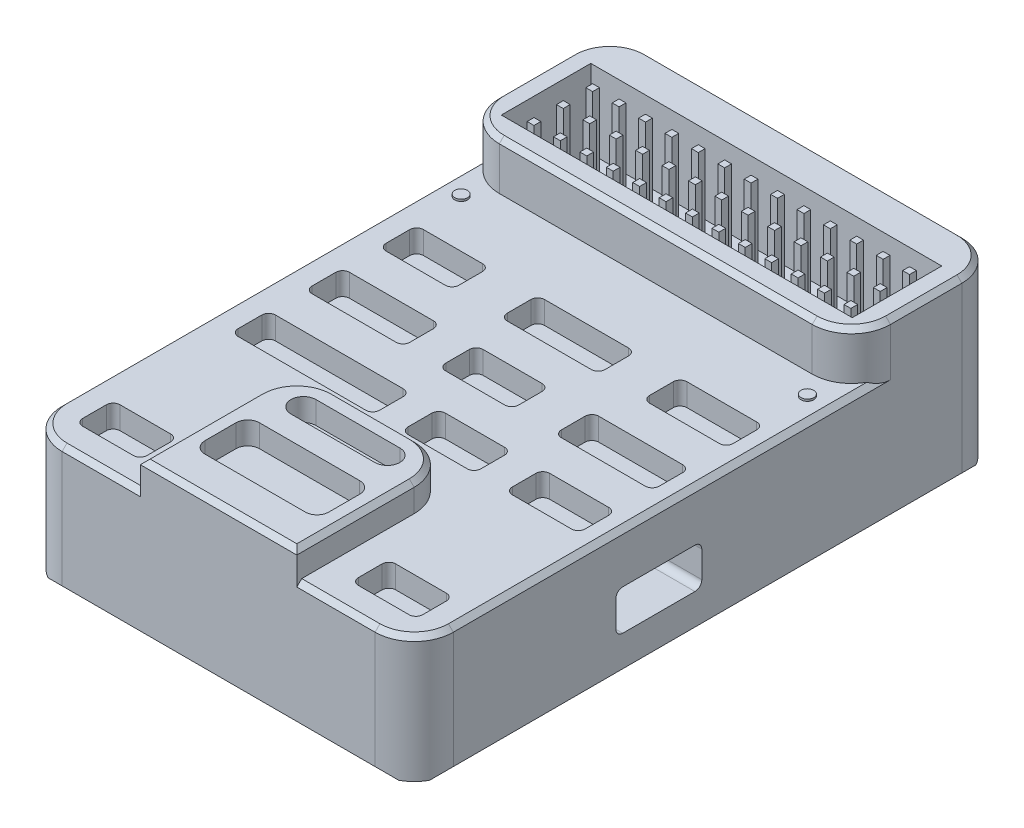
from build123d import *

# Parameters (mm, degrees)
SKETCH_1_W          = 40
SKETCH_1_H          = 60
EXTRUDE_1_DEPTH     = 17.8
SKETCH_2_W          = 44.7
SKETCH_2_H          = 4.9
CUT_EXTRUDE_1_DEPTH = 75.275433355
SKETCH_2_3_W        = 8.783921093
SKETCH_2_3_H        = 4.10647225
CUT_EXTRUDE_2_DEPTH = 5
CUT_EXTRUDE_3_DEPTH = 1.5
CUT_EXTRUDE_4_DEPTH = 4
SKETCH_4_W          = 16
SKETCH_4_H          = 2.833978106
EXTRUDE_2_DEPTH     = 16
SKETCH_5_W          = 7.440863623
SKETCH_5_H          = 3.815065683
SKETCH_5_W_2        = 4.996894502
SKETCH_5_W_3        = 8.530183119
SKETCH_5_W_4        = 3.720431812
SKETCH_5_H_2        = 3.815065684
SKETCH_5_W_5        = 9.986756652
SKETCH_5_W_6        = 14.458699844
SKETCH_5_W_7        = 6.575740644
CUT_EXTRUDE_5_DEPTH = 2.3
SKETCH_6_W          = 12.655666406
SKETCH_6_H          = 5.566059253
CUT_EXTRUDE_6_DEPTH = 2.3
CHAMFER_1_SIZE      = 0.5
FILLET_1_R          = 4
FILLET_2_R          = 4
CHAMFER_10_SIZE     = 0.5
CHAMFER_11_SIZE     = 0.5
FILLET_3_R          = 4
CHAMFER_13_SIZE     = 0.5
SKETCH_9_W          = 17.942606246
SKETCH_9_H          = 9.150280341
CUT_EXTRUDE_7_DEPTH = 8
SKETCH_10_W         = 0.7
SKETCH_10_H         = 0.7
SKETCH_10_W_2       = 0.35
EXTRUDE_5_DEPTH     = 7.5
FILLET_5_R          = 0.7
FILLET_6_R          = 1.2
SKETCH_11_R         = 0.65
EXTRUDE_6_DEPTH     = 0.2


with BuildPart() as part:
    # 草图1 → 凸台-拉伸1 (new body)
    with BuildSketch(Plane(origin=(0, 0, 0), x_dir=(1, 0, 0), z_dir=(0, 1, 0))):
        with Locations((0, 30)):
            Rectangle(SKETCH_1_W, SKETCH_1_H)
    extrude(amount=EXTRUDE_1_DEPTH)

    # 草图2 → 切除-拉伸1 (cut, through all)
    with BuildSketch(Plane.ZY.offset(20)):
        with Locations((-22.35, 15.35)):
            Rectangle(SKETCH_2_W, SKETCH_2_H)
    extrude(amount=-CUT_EXTRUDE_1_DEPTH, mode=Mode.SUBTRACT)

    # 草图2<3> → 切除-拉伸2 (cut)
    with BuildSketch(Plane.ZY.offset(20)):
        with Locations((-25.013417227, 5.703760213)):
            Rectangle(SKETCH_2_3_W, SKETCH_2_3_H)
    cut_extrude_2 = extrude(amount=-CUT_EXTRUDE_2_DEPTH, mode=Mode.SUBTRACT)

    # 草图2<4> → 切除-拉伸3 (cut)
    with BuildSketch(Plane.ZY.offset(20)):
        with BuildLine():
            Line((-40.852927108, 4.403976456), (-34.855352364, 4.403976456))
            ThreePointArc((-34.855352364, 4.403976456), (-33.127203267, 6.132125553), (-34.855352364, 7.86027465))
            Line((-34.855352364, 7.86027465), (-40.852927108, 7.86027465))
            ThreePointArc((-40.852927108, 7.86027465), (-42.581076205, 6.132125553), (-40.852927108, 4.403976456))
        make_face()
        with BuildLine():
            ThreePointArc((-34.855352364, 4.896989878), (-33.620216689, 6.132125553), (-34.855352364, 7.367261227))
            Line((-34.855352364, 7.367261227), (-40.852927108, 7.367261227))
            ThreePointArc((-40.852927108, 7.367261227), (-42.088062782, 6.132125553), (-40.852927108, 4.896989878))
            Line((-40.852927108, 4.896989878), (-34.855352364, 4.896989878))
        make_face(mode=Mode.SUBTRACT)
    extrude(amount=-CUT_EXTRUDE_3_DEPTH, mode=Mode.SUBTRACT)

    # 草图2<5> → 切除-拉伸4 (cut)
    with BuildSketch(Plane.ZY.offset(20)):
        with BuildLine():
            Line((-40.852927108, 4.896989878), (-34.855352364, 4.896989878))
            ThreePointArc((-34.855352364, 4.896989878), (-33.620216689, 6.132125553), (-34.855352364, 7.367261227))
            Line((-34.855352364, 7.367261227), (-40.852927108, 7.367261227))
            ThreePointArc((-40.852927108, 7.367261227), (-42.088062782, 6.132125553), (-40.852927108, 4.896989878))
        make_face()
    extrude(amount=-CUT_EXTRUDE_4_DEPTH, mode=Mode.SUBTRACT)

    # 草图4 → 凸台-拉伸2 (add)
    with BuildSketch(Plane.XY):
        with Locations((0, 14.316989053)):
            Rectangle(SKETCH_4_W, SKETCH_4_H)
    extrude(amount=-EXTRUDE_2_DEPTH)

    # 草图5 → 切除-拉伸5 (cut)
    with BuildSketch(Plane(origin=(0, 12.9, 0), x_dir=(1, 0, 0), z_dir=(0, 1, 0))):
        with Locations((-13.66223089, 35.720151077)):
            Rectangle(SKETCH_5_W, SKETCH_5_H)
        with Locations((-2.498447251, 35.720151077)):
            Rectangle(SKETCH_5_W_2, SKETCH_5_H)
        with Locations((2.498447251, 35.720151077)):
            Rectangle(SKETCH_5_W_2, SKETCH_5_H)
        with Locations((13.828753223, 35.720151077)):
            Rectangle(SKETCH_5_W_3, SKETCH_5_H)
        with Locations((1.860215906, 28.155085393)):
            Rectangle(SKETCH_5_W_4, SKETCH_5_H_2)
        with Locations((-1.860215906, 28.155085393)):
            Rectangle(SKETCH_5_W_4, SKETCH_5_H_2)
        with Locations((13.100466456, 28.155085393)):
            Rectangle(SKETCH_5_W_5, SKETCH_5_H_2)
        with Locations((14.373412971, 20.59001971)):
            Rectangle(SKETCH_5_W, SKETCH_5_H)
        with Locations((3.720431812, 20.59001971)):
            Rectangle(SKETCH_5_W, SKETCH_5_H)
        with Locations((-10.153312779, 20.59001971)):
            Rectangle(SKETCH_5_W_6, SKETCH_5_H)
        with Locations((-14.094792379, 4.696074943)):
            Rectangle(SKETCH_5_W_7, SKETCH_5_H_2)
        with Locations((14.094792379, 4.696074943)):
            Rectangle(SKETCH_5_W_7, SKETCH_5_H_2)
        with Locations((-12.389284375, 28.155085393)):
            Rectangle(SKETCH_5_W_5, SKETCH_5_H_2)
    extrude(amount=-CUT_EXTRUDE_5_DEPTH, mode=Mode.SUBTRACT)

    # 草图6 → 切除-拉伸6 (cut)
    with BuildSketch(Plane(origin=(0, 15.733978106, 0), x_dir=(1, 0, 0), z_dir=(0, 1, 0))):
        with BuildLine():
            Line((-4.290864131, 14.247636384), (4.290864131, 14.247636384))
            ThreePointArc((4.290864131, 14.247636384), (5.571719095, 12.966781419), (4.290864131, 11.685926455))
            Line((4.290864131, 11.685926455), (-4.290864131, 11.685926455))
            ThreePointArc((-4.290864131, 11.685926455), (-5.571719095, 12.966781419), (-4.290864131, 14.247636384))
        make_face()
        with Locations((0, 6.521067289)):
            Rectangle(SKETCH_6_W, SKETCH_6_H)
    extrude(amount=-CUT_EXTRUDE_6_DEPTH, mode=Mode.SUBTRACT)

    # 镜向1: 切除-拉伸2 across plane
    add(cut_extrude_2.mirror(Plane(origin=(0, 0, 0), x_dir=(0, 0, 1), z_dir=(1, 0, 0))), mode=Mode.SUBTRACT)

    # 倒角1
    chamfer_1_edges = [part.edges().sort_by_distance(p)[0] for p in [
        (0, 0, 0),
        (-20, 0, -30),
        (0, 0, -60),
        (20, 0, -30),
    ]]
    chamfer(chamfer_1_edges, length=CHAMFER_1_SIZE)

    # 圆角1
    # the kernel refuses this fillet: 4 mm, written as the material it takes off along each edge
    with BuildSketch(Plane(origin=(-20, -9.5, -60), x_dir=(0, 0, 1), z_dir=(0, 1, 0))) as fillet_1_piece_1:
        with BuildLine():
            CenterArc((FILLET_1_R, FILLET_1_R), FILLET_1_R, 180, 90)
            Line((0, FILLET_1_R), (0, 0))
            Line((0, 0), (FILLET_1_R, 0))
        make_face()
    extrude(amount=37.3, mode=Mode.SUBTRACT)
    with BuildSketch(Plane(origin=(20, -9.5, -60), x_dir=(0, 0, 1), z_dir=(0, 1, 0))) as fillet_1_piece_2:
        with BuildLine():
            CenterArc((FILLET_1_R, -FILLET_1_R), FILLET_1_R, 90, 90)
            Line((0, -FILLET_1_R), (0, 0))
            Line((0, 0), (FILLET_1_R, 0))
        make_face()
    extrude(amount=37.3, mode=Mode.SUBTRACT)
    with BuildSketch(Plane(origin=(20, -9.5, 0), x_dir=(-1, 0, 0), z_dir=(0, 1, 0))) as fillet_1_piece_3:
        with BuildLine():
            CenterArc((FILLET_1_R, -FILLET_1_R), FILLET_1_R, 90, 90)
            Line((0, -FILLET_1_R), (0, 0))
            Line((0, 0), (FILLET_1_R, 0))
        make_face()
    extrude(amount=32.4, mode=Mode.SUBTRACT)
    with BuildSketch(Plane(origin=(-20, -9.5, 0), x_dir=(1, 0, 0), z_dir=(0, 1, 0))) as fillet_1_piece_4:
        with BuildLine():
            CenterArc((FILLET_1_R, FILLET_1_R), FILLET_1_R, 180, 90)
            Line((0, FILLET_1_R), (0, 0))
            Line((0, 0), (FILLET_1_R, 0))
        make_face()
    extrude(amount=32.4, mode=Mode.SUBTRACT)

    # 圆角2
    fillet_2_edges = [part.edges().sort_by_distance(p)[0] for p in [
        (8, 14.316989053, -16),
        (-8, 14.316989053, -16),
    ]]
    fillet(fillet_2_edges, radius=FILLET_2_R)

    # 倒角10
    chamfer_10_edges = [part.edges().sort_by_distance(p)[0] for p in [
        (8, 15.733978106, -6),
        (0, 15.733978106, -16),
        (-8, 15.733978106, -6),
        (-6.828427125, 15.733978106, -14.828427125),
        (6.828427125, 15.733978106, -14.828427125),
        (0, 15.733978106, 0),
    ]]
    chamfer(chamfer_10_edges, length=CHAMFER_10_SIZE)

    # 倒角11
    chamfer_11_edges = [part.edges().sort_by_distance(p)[0] for p in [
        (20, 12.9, -24.35),
        (-20, 12.9, -24.35),
        (12, 12.9, 0),
        (-18.828427125, 12.9, -1.171572875),
        (18.828427125, 12.9, -1.171572875),
        (-12, 12.9, 0),
    ]]
    chamfer(chamfer_11_edges, length=CHAMFER_11_SIZE)

    # 圆角3
    # the kernel refuses this fillet: 4 mm, written as the material it takes off along each edge
    with BuildSketch(Plane(origin=(20, 2.4, -44.7), x_dir=(-1, 0, 0), z_dir=(0, 1, 0))) as fillet_3_piece_1_section:
        with BuildLine():
            CenterArc((FILLET_3_R, -FILLET_3_R), FILLET_3_R, 90, 90)
            Line((0, -FILLET_3_R), (0, 0))
            Line((0, 0), (FILLET_3_R, 0))
        make_face()
    fillet_3_piece_1 = extrude(amount=25.4, mode=Mode.PRIVATE)
    fillet_3_piece_1 = split(fillet_3_piece_1, bisect_by=Plane(origin=(19.807797246, 12.592202754, -46.321821662), z_dir=(0.7071067811865476, 0.7071067811865476, 0)), keep=Keep.TOP, mode=Mode.PRIVATE)
    fillet_3_piece_1 = split(fillet_3_piece_1, bisect_by=Plane(origin=(19.910396328, 12.9, -46.321821662), z_dir=(0, -1, 0)), keep=Keep.TOP, mode=Mode.PRIVATE)
    add(fillet_3_piece_1, mode=Mode.SUBTRACT)
    with BuildSketch(Plane(origin=(20, 2.4, -44.7), x_dir=(-1, 0, 0), z_dir=(0, 1, 0))) as fillet_3_piece_2_section:
        with BuildLine():
            CenterArc((FILLET_3_R, -FILLET_3_R), FILLET_3_R, 90, 90)
            Line((0, -FILLET_3_R), (0, 0))
            Line((0, 0), (FILLET_3_R, 0))
        make_face()
    fillet_3_piece_2 = extrude(amount=25.4, mode=Mode.PRIVATE)
    fillet_3_piece_2 = split(fillet_3_piece_2, bisect_by=Plane(origin=(18.319586049, 14.080413951, -44.974185182), z_dir=(-0.7071067811865476, -0.7071067811865476, 0)), keep=Keep.TOP, mode=Mode.PRIVATE)
    fillet_3_piece_2 = split(fillet_3_piece_2, bisect_by=Plane(origin=(17.926114732, 12.9, -44.974185182), z_dir=(0, 1, 0)), keep=Keep.TOP, mode=Mode.PRIVATE)
    add(fillet_3_piece_2, mode=Mode.SUBTRACT)
    with BuildSketch(Plane(origin=(20, 2.4, -44.7), x_dir=(-1, 0, 0), z_dir=(0, 1, 0))) as fillet_3_piece_3_section:
        with BuildLine():
            CenterArc((FILLET_3_R, -FILLET_3_R), FILLET_3_R, 90, 90)
            Line((0, -FILLET_3_R), (0, 0))
            Line((0, 0), (FILLET_3_R, 0))
        make_face()
    fillet_3_piece_3 = extrude(amount=25.4, mode=Mode.PRIVATE)
    fillet_3_piece_3 = split(fillet_3_piece_3, bisect_by=Plane(origin=(15.468590175, 16.931409825, -45.629394059), z_dir=(0.7071067811865476, 0.7071067811865476, 0)), keep=Keep.TOP, mode=Mode.PRIVATE)
    fillet_3_piece_3 = split(fillet_3_piece_3, bisect_by=Plane(origin=(19.138483137, 12.9, -45.629394059), z_dir=(0, 1, 0)), keep=Keep.TOP, mode=Mode.PRIVATE)
    add(fillet_3_piece_3, mode=Mode.SUBTRACT)
    with BuildSketch(Plane(origin=(-20, 27.8, -44.7), x_dir=(1, 0, 0), z_dir=(0, -1, 0))) as fillet_3_piece_4_section:
        with BuildLine():
            CenterArc((FILLET_3_R, -FILLET_3_R), FILLET_3_R, 90, 90)
            Line((0, -FILLET_3_R), (0, 0))
            Line((0, 0), (FILLET_3_R, 0))
        make_face()
    fillet_3_piece_4 = extrude(amount=25.4, mode=Mode.PRIVATE)
    fillet_3_piece_4 = split(fillet_3_piece_4, bisect_by=Plane(origin=(-19.138483137, 12.9, -45.629394059), z_dir=(0, 1, 0)), keep=Keep.TOP, mode=Mode.PRIVATE)
    fillet_3_piece_4 = split(fillet_3_piece_4, bisect_by=Plane(origin=(-15.468590175, 16.931409825, -45.629394059), z_dir=(-0.7071067811865476, 0.7071067811865476, 0)), keep=Keep.TOP, mode=Mode.PRIVATE)
    add(fillet_3_piece_4, mode=Mode.SUBTRACT)
    with BuildSketch(Plane(origin=(-20, 27.8, -44.7), x_dir=(1, 0, 0), z_dir=(0, -1, 0))) as fillet_3_piece_5_section:
        with BuildLine():
            CenterArc((FILLET_3_R, -FILLET_3_R), FILLET_3_R, 90, 90)
            Line((0, -FILLET_3_R), (0, 0))
            Line((0, 0), (FILLET_3_R, 0))
        make_face()
    fillet_3_piece_5 = extrude(amount=25.4, mode=Mode.PRIVATE)
    fillet_3_piece_5 = split(fillet_3_piece_5, bisect_by=Plane(origin=(-19.910396328, 12.9, -46.321821662), z_dir=(0, -1, 0)), keep=Keep.TOP, mode=Mode.PRIVATE)
    fillet_3_piece_5 = split(fillet_3_piece_5, bisect_by=Plane(origin=(-19.807797246, 12.592202754, -46.321821662), z_dir=(-0.7071067811865476, 0.7071067811865476, 0)), keep=Keep.TOP, mode=Mode.PRIVATE)
    add(fillet_3_piece_5, mode=Mode.SUBTRACT)
    with BuildSketch(Plane(origin=(-20, 27.8, -44.7), x_dir=(1, 0, 0), z_dir=(0, -1, 0))) as fillet_3_piece_6_section:
        with BuildLine():
            CenterArc((FILLET_3_R, -FILLET_3_R), FILLET_3_R, 90, 90)
            Line((0, -FILLET_3_R), (0, 0))
            Line((0, 0), (FILLET_3_R, 0))
        make_face()
    fillet_3_piece_6 = extrude(amount=25.4, mode=Mode.PRIVATE)
    fillet_3_piece_6 = split(fillet_3_piece_6, bisect_by=Plane(origin=(-17.926114732, 12.9, -44.974185182), z_dir=(0, 1, 0)), keep=Keep.TOP, mode=Mode.PRIVATE)
    fillet_3_piece_6 = split(fillet_3_piece_6, bisect_by=Plane(origin=(-18.319586049, 14.080413951, -44.974185182), z_dir=(0.7071067811865476, -0.7071067811865476, 0)), keep=Keep.TOP, mode=Mode.PRIVATE)
    add(fillet_3_piece_6, mode=Mode.SUBTRACT)

    # 倒角13
    chamfer_13_edges = [part.edges().sort_by_distance(p)[0] for p in [
        (-20, 17.8, -52.35),
        (0, 17.8, -60),
        (18.828427125, 17.8, -58.828427125),
        (-18.828427125, 17.8, -58.828427125),
        (20, 17.8, -52.35),
        (0, 17.8, -44.7),
        (-18.828427125, 17.8, -45.871572875),
        (18.828427125, 17.8, -45.871572875),
    ]]
    chamfer(chamfer_13_edges, length=CHAMFER_13_SIZE)

    # 草图9 → 切除-拉伸7 (cut)
    with BuildSketch(Plane(origin=(0, 17.8, 0), x_dir=(1, 0, 0), z_dir=(0, 1, 0))):
        with Locations((-8.971303123, 51.42485983)):
            Rectangle(SKETCH_9_W, SKETCH_9_H)
        with Locations((8.971303123, 51.42485983)):
            Rectangle(SKETCH_9_W, SKETCH_9_H)
    extrude(amount=-CUT_EXTRUDE_7_DEPTH, mode=Mode.SUBTRACT)

    # 草图10 → 凸台-拉伸5 (add)
    with BuildSketch(Plane(origin=(0, 9.8, 0), x_dir=(1, 0, 0), z_dir=(0, 1, 0))):
        with Locations((-16.2, 54.445907043)):
            Rectangle(SKETCH_10_W, SKETCH_10_H)
        with Locations((-16.2, 51.445907043)):
            Rectangle(SKETCH_10_W, SKETCH_10_H)
        with Locations((-16.2, 48.445907043)):
            Rectangle(SKETCH_10_W, SKETCH_10_H)
        with Locations((-13.5, 48.445907043)):
            Rectangle(SKETCH_10_W, SKETCH_10_H)
        with Locations((-13.5, 51.445907043)):
            Rectangle(SKETCH_10_W, SKETCH_10_H)
        with Locations((-13.5, 54.445907043)):
            Rectangle(SKETCH_10_W, SKETCH_10_H)
        with Locations((-10.8, 54.445907043)):
            Rectangle(SKETCH_10_W, SKETCH_10_H)
        with Locations((-10.8, 51.445907043)):
            Rectangle(SKETCH_10_W, SKETCH_10_H)
        with Locations((-10.8, 48.445907043)):
            Rectangle(SKETCH_10_W, SKETCH_10_H)
        with Locations((-8.1, 48.445907043)):
            Rectangle(SKETCH_10_W, SKETCH_10_H)
        with Locations((-5.4, 48.445907043)):
            Rectangle(SKETCH_10_W, SKETCH_10_H)
        with Locations((-2.7, 48.445907043)):
            Rectangle(SKETCH_10_W, SKETCH_10_H)
        with Locations((-2.7, 51.445907043)):
            Rectangle(SKETCH_10_W, SKETCH_10_H)
        with Locations((-5.4, 51.445907043)):
            Rectangle(SKETCH_10_W, SKETCH_10_H)
        with Locations((-8.1, 51.445907043)):
            Rectangle(SKETCH_10_W, SKETCH_10_H)
        with Locations((-5.4, 54.445907043)):
            Rectangle(SKETCH_10_W, SKETCH_10_H)
        with Locations((-2.7, 54.445907043)):
            Rectangle(SKETCH_10_W, SKETCH_10_H)
        with Locations((-0.175, 54.445907043)):
            Rectangle(SKETCH_10_W_2, SKETCH_10_H)
        with Locations((0.175, 54.445907043)):
            Rectangle(SKETCH_10_W_2, SKETCH_10_H)
        with Locations((-0.175, 51.445907043)):
            Rectangle(SKETCH_10_W_2, SKETCH_10_H)
        with Locations((0.175, 51.445907043)):
            Rectangle(SKETCH_10_W_2, SKETCH_10_H)
        with Locations((-0.175, 48.445907043)):
            Rectangle(SKETCH_10_W_2, SKETCH_10_H)
        with Locations((0.175, 48.445907043)):
            Rectangle(SKETCH_10_W_2, SKETCH_10_H)
        with Locations((2.7, 51.445907043)):
            Rectangle(SKETCH_10_W, SKETCH_10_H)
        with Locations((2.7, 54.445907043)):
            Rectangle(SKETCH_10_W, SKETCH_10_H)
        with Locations((5.4, 54.445907043)):
            Rectangle(SKETCH_10_W, SKETCH_10_H)
        with Locations((5.4, 51.445907043)):
            Rectangle(SKETCH_10_W, SKETCH_10_H)
        with Locations((8.1, 48.445907043)):
            Rectangle(SKETCH_10_W, SKETCH_10_H)
        with Locations((8.1, 51.445907043)):
            Rectangle(SKETCH_10_W, SKETCH_10_H)
        with Locations((8.1, 54.445907043)):
            Rectangle(SKETCH_10_W, SKETCH_10_H)
        with Locations((10.8, 54.445907043)):
            Rectangle(SKETCH_10_W, SKETCH_10_H)
        with Locations((10.8, 51.445907043)):
            Rectangle(SKETCH_10_W, SKETCH_10_H)
        with Locations((10.8, 48.445907043)):
            Rectangle(SKETCH_10_W, SKETCH_10_H)
        with Locations((13.5, 48.445907043)):
            Rectangle(SKETCH_10_W, SKETCH_10_H)
        with Locations((13.5, 51.445907043)):
            Rectangle(SKETCH_10_W, SKETCH_10_H)
        with Locations((13.5, 54.445907043)):
            Rectangle(SKETCH_10_W, SKETCH_10_H)
        with Locations((16.2, 54.445907043)):
            Rectangle(SKETCH_10_W, SKETCH_10_H)
        with Locations((16.2, 51.445907043)):
            Rectangle(SKETCH_10_W, SKETCH_10_H)
        with Locations((16.2, 48.445907043)):
            Rectangle(SKETCH_10_W, SKETCH_10_H)
        with Locations((-8.1, 54.445907043)):
            Rectangle(SKETCH_10_W, SKETCH_10_H)
        with Locations((2.7, 48.445907043)):
            Rectangle(SKETCH_10_W, SKETCH_10_H)
        with Locations((5.4, 48.445907043)):
            Rectangle(SKETCH_10_W, SKETCH_10_H)
    extrude(amount=EXTRUDE_5_DEPTH)

    # 圆角5
    fillet_5_edges = [part.edges().sort_by_distance(p)[0] for p in [
        (4.996894502, 11.75, -33.812618235),
        (-4.996894502, 11.75, -33.812618235),
        (-4.996894502, 11.75, -37.627683918),
        (4.996894502, 11.75, -37.627683918),
        (18.093844782, 11.75, -37.627683918),
        (18.093844782, 11.75, -33.812618235),
        (9.563661663, 11.75, -33.812618235),
        (9.563661663, 11.75, -37.627683918),
        (-3.720431812, 11.75, -30.062618235),
        (3.720431812, 11.75, -30.062618235),
        (3.720431812, 11.75, -26.247552551),
        (-3.720431812, 11.75, -26.247552551),
        (18.093844782, 11.75, -30.062618235),
        (18.093844782, 11.75, -26.247552551),
        (8.10708813, 11.75, -26.247552551),
        (8.10708813, 11.75, -30.062618235),
        (18.093844782, 11.75, -22.497552551),
        (18.093844782, 11.75, -18.682486868),
        (10.652981159, 11.75, -18.682486868),
        (10.652981159, 11.75, -22.497552551),
        (7.440863623, 11.75, -22.497552551),
        (7.440863623, 11.75, -18.682486868),
        (0, 11.75, -18.682486868),
        (0, 11.75, -22.497552551),
        (-2.923962857, 11.75, -22.497552551),
        (-2.923962857, 11.75, -18.682486868),
        (-17.382662701, 11.75, -18.682486868),
        (-17.382662701, 11.75, -22.497552551),
        (-10.806922057, 11.75, -6.603607785),
        (-10.806922057, 11.75, -2.788542101),
        (-17.382662701, 11.75, -2.788542101),
        (-17.382662701, 11.75, -6.603607785),
        (17.382662701, 11.75, -6.603607785),
        (17.382662701, 11.75, -2.788542101),
        (10.806922057, 11.75, -2.788542101),
        (10.806922057, 11.75, -6.603607785),
        (-7.395906049, 11.75, -26.247552551),
        (-7.395906049, 11.75, -30.062618235),
        (-17.382662701, 11.75, -30.062618235),
        (-17.382662701, 11.75, -26.247552551),
        (-9.941799078, 11.75, -37.627683918),
        (-9.941799078, 11.75, -33.812618235),
        (-17.382662701, 11.75, -33.812618235),
        (-17.382662701, 11.75, -37.627683918),
        (17.5, 3.650524088, -20.621456681),
        (17.5, 7.756996338, -20.621456681),
        (17.5, 7.756996338, -29.405377774),
        (17.5, 3.650524088, -29.405377774),
        (-17.5, 7.756996338, -20.621456681),
        (-17.5, 3.650524088, -20.621456681),
        (-17.5, 3.650524088, -29.405377774),
        (-17.5, 7.756996338, -29.405377774),
    ]]
    fillet(fillet_5_edges, radius=FILLET_5_R)

    # 圆角6
    fillet_6_edges = [part.edges().sort_by_distance(p)[0] for p in [
        (-6.327833203, 14.583978106, -3.738037662),
        (-6.327833203, 14.583978106, -9.304096915),
        (6.327833203, 14.583978106, -9.304096915),
        (6.327833203, 14.583978106, -3.738037662),
    ]]
    fillet(fillet_6_edges, radius=FILLET_6_R)

    # 草图11 → 凸台-拉伸6 (add)
    with BuildSketch(Plane(origin=(0, 12.9, 0), x_dir=(1, 0, 0), z_dir=(0, 1, 0))):
        with Locations(Location((-17.7, 42.5, 0), (0, 0, 90))):
            Circle(SKETCH_11_R)
        with Locations(Location((17.7, 42.5, 0), (0, 0, 270))):
            Circle(SKETCH_11_R)
    extrude(amount=EXTRUDE_6_DEPTH)


solid = part.part
